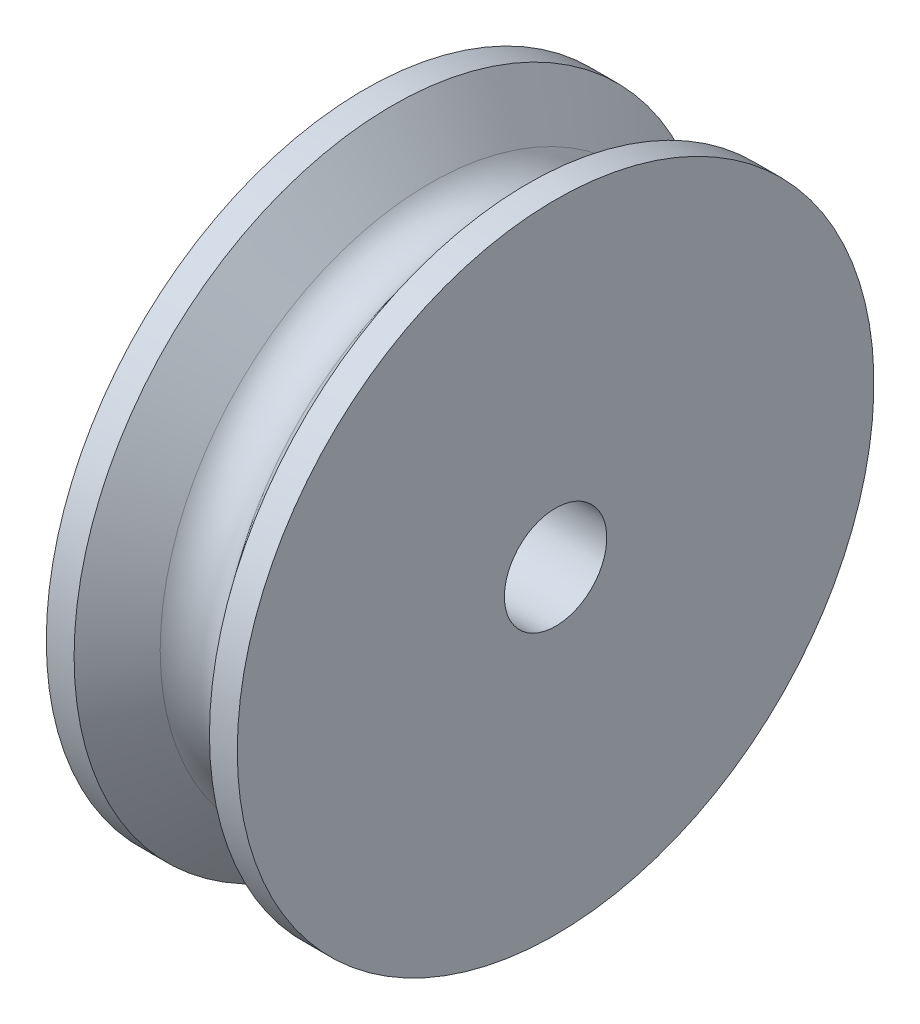
from build123d import *


with BuildPart() as part:
    # Sketch1 → Revolve1 (revolve)
    with BuildSketch(Plane.XY):
        with BuildLine():
            Line((0, 2.5527), (9.525, 2.5527))
            Line((9.525, 2.5527), (9.525, 15.875))
            Line((9.525, 15.875), (8.138205223, 15.875))
            Line((8.138205223, 15.875), (6.273838113, 13.445309478))
            ThreePointArc((6.273838113, 13.445309478), (4.7625, 12.7), (3.251161887, 13.445309478))
            Line((3.251161887, 13.445309478), (1.386794777, 15.875))
            Line((1.386794777, 15.875), (0, 15.875))
            Line((0, 15.875), (0, 2.5527))
        make_face()
    revolve(axis=Axis((0, 0, 0), (1, 0, 0)))


solid = part.part
